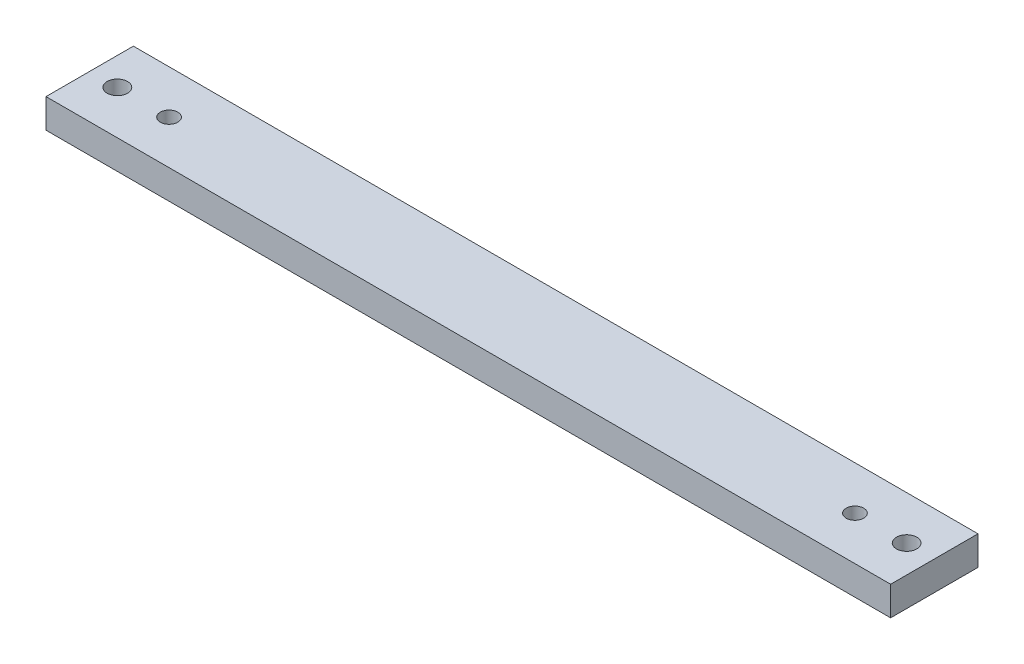
from build123d import *

# Parameters (mm, degrees)
SKETCH3_W           = 580
SKETCH3_H           = 60
BOSS_EXTRUDE1_DEPTH = 20
SKETCH4_R           = 7
SKETCH4_R_2         = 6
CUT_EXTRUDE1_DEPTH  = 586.832740635


with BuildPart() as part:
    # Sketch3 → Boss-Extrude1 (new body)
    with BuildSketch(Plane(origin=(0, 0, 0), x_dir=(1, 0, 0), z_dir=(0, 1, 0))):
        with Locations((290, 50)):
            Rectangle(SKETCH3_W, SKETCH3_H)
    extrude(amount=BOSS_EXTRUDE1_DEPTH)

    # Sketch4 → Cut-Extrude1 (cut, through all)
    with BuildSketch(Plane(origin=(0, 20, 0), x_dir=(1, 0, 0), z_dir=(0, 1, 0))):
        with Locations((19, 50)):
            Circle(SKETCH4_R)
        with Locations((54.5, 50)):
            Circle(SKETCH4_R_2)
        with Locations((525.5, 50)):
            Circle(SKETCH4_R_2)
        with Locations((561, 50)):
            Circle(SKETCH4_R)
    extrude(amount=-CUT_EXTRUDE1_DEPTH, mode=Mode.SUBTRACT)


solid = part.part
